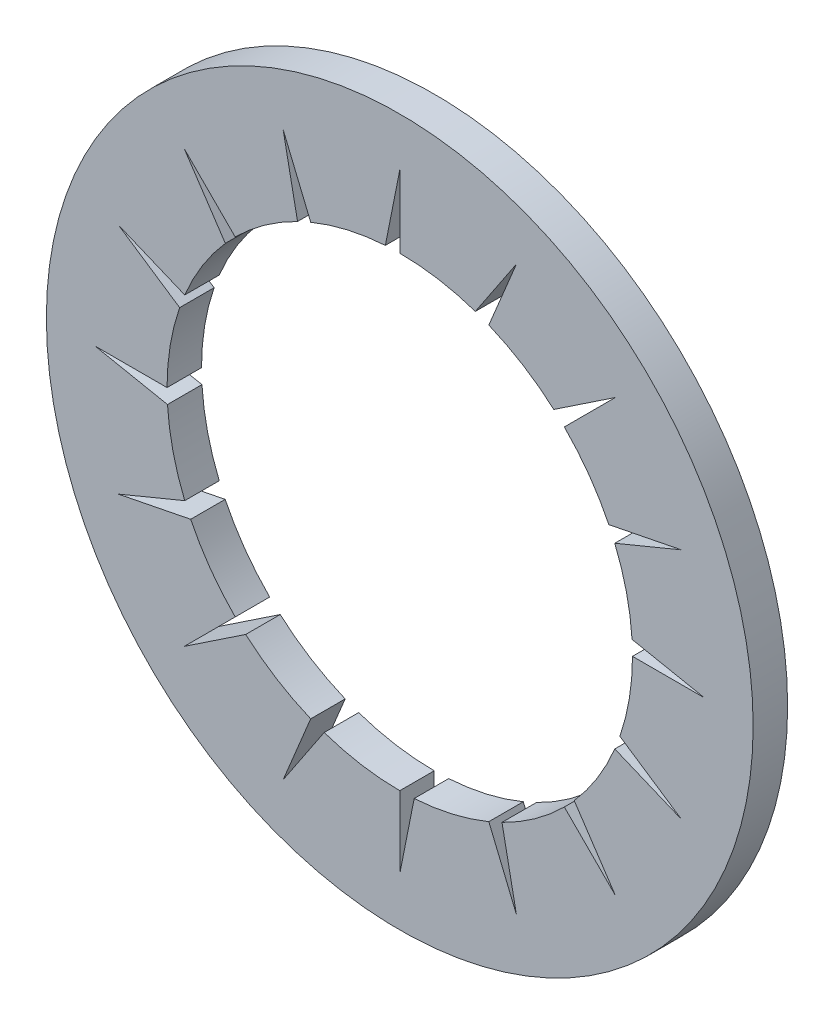
from build123d import *

# Parameters (mm, degrees)
BODYSKE_W      = 3.5
BODYSKE_H      = 1
TOOTHCUT_DEPTH = 15.530141087
TOOTHPAT_COUNT = 16


with BuildPart() as part:
    # BodySke → BaseBody (revolve)
    with BuildSketch(Plane(origin=(0, 0, 0), x_dir=(1, 0, 0), z_dir=(0, 1, 0))):
        with Locations((8.5, 0.5)):
            Rectangle(BODYSKE_W, BODYSKE_H)
    revolve(axis=Axis((0, 0, 0), (0, 0, -1)))

    # ToothSke → ToothCut (cut, through all)
    with BuildSketch(Plane.XY):
        with BuildLine():
            Line((0, 8.84), (-0.418307545, 6.737025961))
            ThreePointArc((-0.418307545, 6.737025961), (-0.209254347, 6.746755711), (0, 6.75))
            Line((0, 6.75), (0, 8.84))
        make_face()
    toothcut = extrude(amount=-TOOTHCUT_DEPTH, mode=Mode.SUBTRACT)

    # ToothPat: ToothCut ×16 about axis
    toothpat_axis = Axis((0, 0, 0), (0, 0, -1))
    for i in range(1, TOOTHPAT_COUNT):
        add(toothcut.rotate(toothpat_axis, i * 360 / TOOTHPAT_COUNT), mode=Mode.SUBTRACT)


solid = part.part
